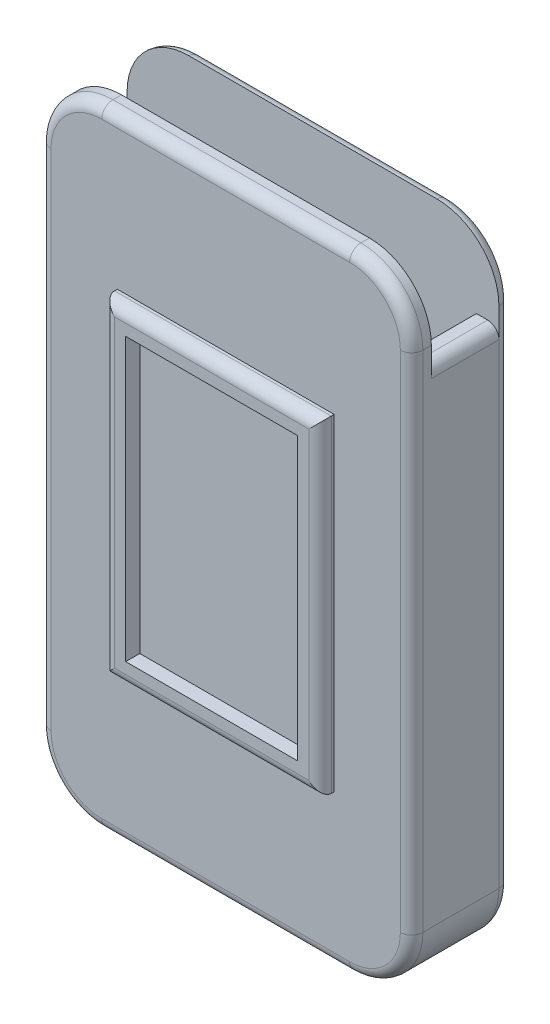
from build123d import *

# Parameters (mm, degrees)
CROQUIS1_W              = 44
CROQUIS1_H              = 78.5
SALIENTE_EXTRUIR1_DEPTH = 2
SALIENTE_EXTRUIR2_DEPTH = 12
CROQUIS3_W              = 44
CROQUIS3_H              = 78.5
SALIENTE_EXTRUIR3_DEPTH = 3.5
CROQUIS4_W              = 30.5
CROQUIS4_H              = 50
SALIENTE_EXTRUIR4_DEPTH = 2.5
CROQUIS6_W              = 12
CROQUIS6_H              = 14.873801133
CORTAR_EXTRUIR3_DEPTH   = 4
REDONDEO2_R             = 2
REDONDEO3_R             = 2
REDONDEO4_R             = 2
REDONDEO5_R             = 2
REDONDEO6_R             = 2


with BuildPart() as part:
    # Croquis1 → Saliente-Extruir1 (new body)
    # profile 1 of 2: a face of its own
    with BuildSketch(Plane.XY):
        with BuildLine():
            Line((45.934272818, 29.567618865), (45.934272818, 119.067618865))
            ThreePointArc((45.934272818, 119.067618865), (49.156098225, 126.845793458), (56.934272818, 130.067618865))
            Line((56.934272818, 130.067618865), (100.934272818, 130.067618865))
            ThreePointArc((100.934272818, 130.067618865), (108.712447411, 126.845793458), (111.934272818, 119.067618865))
            Line((111.934272818, 119.067618865), (111.934272818, 29.567618865))
            ThreePointArc((111.934272818, 29.567618865), (108.712447411, 21.789444272), (100.934272818, 18.567618865))
            Line((100.934272818, 18.567618865), (56.934272818, 18.567618865))
            ThreePointArc((56.934272818, 18.567618865), (49.156098225, 21.789444272), (45.934272818, 29.567618865))
        make_face()
        with BuildLine():
            ThreePointArc((56.934272818, 126.067618865), (51.98452535, 124.017366333), (49.934272818, 119.067618865))
            Line((49.934272818, 119.067618865), (49.934272818, 29.567618865))
            ThreePointArc((49.934272818, 29.567618865), (51.98452535, 24.617871397), (56.934272818, 22.567618865))
            Line((56.934272818, 22.567618865), (100.934272818, 22.567618865))
            ThreePointArc((100.934272818, 22.567618865), (105.884020287, 24.617871397), (107.934272818, 29.567618865))
            Line((107.934272818, 29.567618865), (107.934272818, 119.067618865))
            ThreePointArc((107.934272818, 119.067618865), (105.884020287, 124.017366333), (100.934272818, 126.067618865))
            Line((100.934272818, 126.067618865), (56.934272818, 126.067618865))
        make_face(mode=Mode.SUBTRACT)
    # profile 2 of 2: a face of its own
    with BuildSketch(Plane.XY):
        with BuildLine():
            Line((100.934272818, 126.067618865), (56.934272818, 126.067618865))
            ThreePointArc((56.934272818, 126.067618865), (51.98452535, 124.017366333), (49.934272818, 119.067618865))
            Line((49.934272818, 119.067618865), (49.934272818, 29.567618865))
            ThreePointArc((49.934272818, 29.567618865), (51.98452535, 24.617871397), (56.934272818, 22.567618865))
            Line((56.934272818, 22.567618865), (100.934272818, 22.567618865))
            ThreePointArc((100.934272818, 22.567618865), (105.884020287, 24.617871397), (107.934272818, 29.567618865))
            Line((107.934272818, 29.567618865), (107.934272818, 119.067618865))
            ThreePointArc((107.934272818, 119.067618865), (105.884020287, 124.017366333), (100.934272818, 126.067618865))
        make_face()
        with Locations((78.934272818, 68.817618865)):
            Rectangle(CROQUIS1_W, CROQUIS1_H, mode=Mode.SUBTRACT)
    extrude(amount=SALIENTE_EXTRUIR1_DEPTH)

    # Croquis2 → Saliente-Extruir2 (add)
    with BuildSketch(Plane.XY.offset(2)):
        with BuildLine():
            Line((100.934272818, 22.567618865), (56.934272818, 22.567618865))
            ThreePointArc((56.934272818, 22.567618865), (51.98452535, 24.617871397), (49.934272818, 29.567618865))
            Line((49.934272818, 29.567618865), (49.934272818, 115.941419998))
            Line((49.934272818, 115.941419998), (45.934272818, 115.941419998))
            Line((45.934272818, 115.941419998), (45.934272818, 29.567618865))
            ThreePointArc((45.934272818, 29.567618865), (49.156098225, 21.789444272), (56.934272818, 18.567618865))
            Line((56.934272818, 18.567618865), (100.934272818, 18.567618865))
            ThreePointArc((100.934272818, 18.567618865), (108.712447411, 21.789444272), (111.934272818, 29.567618865))
            Line((111.934272818, 29.567618865), (111.934272818, 115.941419998))
            Line((111.934272818, 115.941419998), (107.934272818, 115.941419998))
            Line((107.934272818, 115.941419998), (107.934272818, 29.567618865))
            ThreePointArc((107.934272818, 29.567618865), (105.884020287, 24.617871397), (100.934272818, 22.567618865))
        make_face()
    extrude(amount=SALIENTE_EXTRUIR2_DEPTH)

    # Croquis3 → Saliente-Extruir3 (add)
    # profile 1 of 4: a face of its own
    with BuildSketch(Plane.XY.offset(14)):
        with BuildLine():
            Line((45.934272818, 115.941419998), (49.934272818, 115.941419998))
            Line((49.934272818, 115.941419998), (49.934272818, 119.067618865))
            ThreePointArc((49.934272818, 119.067618865), (51.98452535, 124.017366333), (56.934272818, 126.067618865))
            Line((56.934272818, 126.067618865), (100.934272818, 126.067618865))
            ThreePointArc((100.934272818, 126.067618865), (105.884020287, 124.017366333), (107.934272818, 119.067618865))
            Line((107.934272818, 119.067618865), (107.934272818, 115.941419998))
            Line((107.934272818, 115.941419998), (111.934272818, 115.941419998))
            Line((111.934272818, 115.941419998), (111.934272818, 119.067618865))
            ThreePointArc((111.934272818, 119.067618865), (108.712447411, 126.845793458), (100.934272818, 130.067618865))
            Line((100.934272818, 130.067618865), (56.934272818, 130.067618865))
            ThreePointArc((56.934272818, 130.067618865), (49.156098225, 126.845793458), (45.934272818, 119.067618865))
            Line((45.934272818, 119.067618865), (45.934272818, 115.941419998))
        make_face()
    # profile 2 of 4: a face of its own
    with BuildSketch(Plane.XY.offset(14)):
        with BuildLine():
            Line((107.934272818, 115.941419998), (107.934272818, 29.567618865))
            ThreePointArc((107.934272818, 29.567618865), (105.884020287, 24.617871397), (100.934272818, 22.567618865))
            Line((100.934272818, 22.567618865), (56.934272818, 22.567618865))
            ThreePointArc((56.934272818, 22.567618865), (51.98452535, 24.617871397), (49.934272818, 29.567618865))
            Line((49.934272818, 29.567618865), (49.934272818, 115.941419998))
            Line((49.934272818, 115.941419998), (45.934272818, 115.941419998))
            Line((45.934272818, 115.941419998), (45.934272818, 29.567618865))
            ThreePointArc((45.934272818, 29.567618865), (49.156098225, 21.789444272), (56.934272818, 18.567618865))
            Line((56.934272818, 18.567618865), (100.934272818, 18.567618865))
            ThreePointArc((100.934272818, 18.567618865), (108.712447411, 21.789444272), (111.934272818, 29.567618865))
            Line((111.934272818, 29.567618865), (111.934272818, 115.941419998))
            Line((111.934272818, 115.941419998), (107.934272818, 115.941419998))
        make_face()
    # profile 3 of 4: a face of its own
    with BuildSketch(Plane.XY.offset(14)):
        with BuildLine():
            ThreePointArc((49.934272818, 29.567618865), (51.98452535, 24.617871397), (56.934272818, 22.567618865))
            Line((56.934272818, 22.567618865), (100.934272818, 22.567618865))
            ThreePointArc((100.934272818, 22.567618865), (105.884020287, 24.617871397), (107.934272818, 29.567618865))
            Line((107.934272818, 29.567618865), (107.934272818, 115.941419998))
            Line((107.934272818, 115.941419998), (107.934272818, 119.067618865))
            ThreePointArc((107.934272818, 119.067618865), (105.884020287, 124.017366333), (100.934272818, 126.067618865))
            Line((100.934272818, 126.067618865), (56.934272818, 126.067618865))
            ThreePointArc((56.934272818, 126.067618865), (51.98452535, 124.017366333), (49.934272818, 119.067618865))
            Line((49.934272818, 119.067618865), (49.934272818, 115.941419998))
            Line((49.934272818, 115.941419998), (49.934272818, 29.567618865))
        make_face()
        with Locations((78.934272818, 68.817618865)):
            Rectangle(CROQUIS3_W, CROQUIS3_H, mode=Mode.SUBTRACT)
    # profile 4 of 4: a face of its own
    with BuildSketch(Plane.XY.offset(14)):
        with Locations((78.934272818, 68.817618865)):
            Rectangle(CROQUIS3_W, CROQUIS3_H)
    extrude(amount=SALIENTE_EXTRUIR3_DEPTH)

    # Croquis4 → Saliente-Extruir4 (add)
    with BuildSketch(Plane.XY.offset(17.5)):
        Polygon((59.684272818, 103.317618865), (59.684272818, 99.317618865), (59.684272818, 45.317618865), (98.184272818, 45.317618865), (98.184272818, 103.317618865), align=None)
        with Locations((78.934272818, 74.317618865)):
            Rectangle(CROQUIS4_W, CROQUIS4_H, mode=Mode.SUBTRACT)
    extrude(amount=SALIENTE_EXTRUIR4_DEPTH)

    # Croquis6 → Cortar-Extruir3 (cut)
    with BuildSketch(Plane.ZY.offset(-45.934272818)):
        with Locations((8, 108.504519432)):
            Rectangle(CROQUIS6_W, CROQUIS6_H)
    extrude(amount=-CORTAR_EXTRUIR3_DEPTH, mode=Mode.SUBTRACT)

    # Redondeo2
    redondeo2_edges = [part.edges().sort_by_distance(p)[0] for p in [
        (78.934272818, 18.567618865, 0),
        (108.712447411, 21.789444272, 0),
        (111.934272818, 74.317618865, 0),
        (108.712447411, 126.845793458, 0),
        (78.934272818, 130.067618865, 0),
        (49.156098225, 126.845793458, 0),
        (45.934272818, 74.317618865, 0),
        (49.156098225, 21.789444272, 0),
    ]]
    fillet(redondeo2_edges, radius=REDONDEO2_R - 0.0001)  # a hair under: the kernel refuses the full size

    # Redondeo3
    redondeo3_edges = [part.edges().sort_by_distance(p)[0] for p in [
        (45.934272818, 74.317618865, 17.5),
        (78.934272818, 130.067618865, 17.5),
        (49.156098225, 21.789444272, 17.5),
        (78.934272818, 18.567618865, 17.5),
        (108.712447411, 21.789444272, 17.5),
        (111.934272818, 74.317618865, 17.5),
        (108.712447411, 126.845793458, 17.5),
        (49.156098225, 126.845793458, 17.5),
    ]]
    fillet(redondeo3_edges, radius=REDONDEO3_R)

    # Redondeo4
    redondeo4_edges = [part.edges().sort_by_distance(p)[0] for p in [
        (59.684272818, 74.317618865, 20),
        (78.934272818, 45.317618865, 20),
        (98.184272818, 74.317618865, 20),
        (78.934272818, 103.317618865, 20),
    ]]
    fillet(redondeo4_edges, radius=REDONDEO4_R)

    # Redondeo5
    redondeo5_edges = [part.edges().sort_by_distance(p)[0] for p in [
        (45.934272818, 101.067618865, 8),
    ]]
    fillet(redondeo5_edges, radius=REDONDEO5_R)

    # Redondeo6
    redondeo6_edges = [part.edges().sort_by_distance(p)[0] for p in [
        (111.934272818, 115.941419998, 8),
    ]]
    fillet(redondeo6_edges, radius=REDONDEO6_R)


solid = part.part
